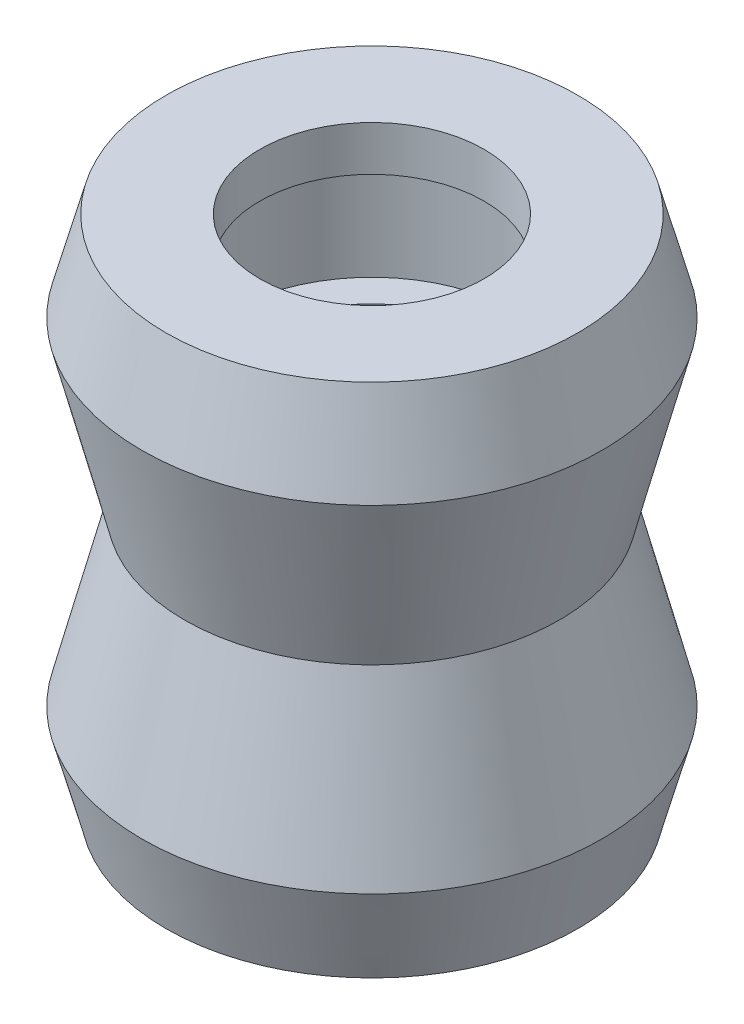
from build123d import *


with BuildPart() as part:
    # Sketch1 → Revolve1 (revolve)
    with BuildSketch(Plane.XY):
        Polygon((5, 11.5), (5, 9.5), (6.45, 9.5), (6.45, 4.5), (5, 4.5), (5, 0), (8.35, 0), (10.25, 7.5), (9.17820323, 11.5), align=None)
    revolve1 = revolve(axis=Axis((0, 11.727044646, 0), (0, -1, 0)))

    # Mirror1: Revolve1 across plane
    add(revolve1.mirror(Plane(origin=(5, 0, 0), x_dir=(0, 0, 1), z_dir=(0, 1, 0))))

    # Mirror2: Revolve1 across plane
    add(revolve1.mirror(Plane.ZX))


solid = part.part
